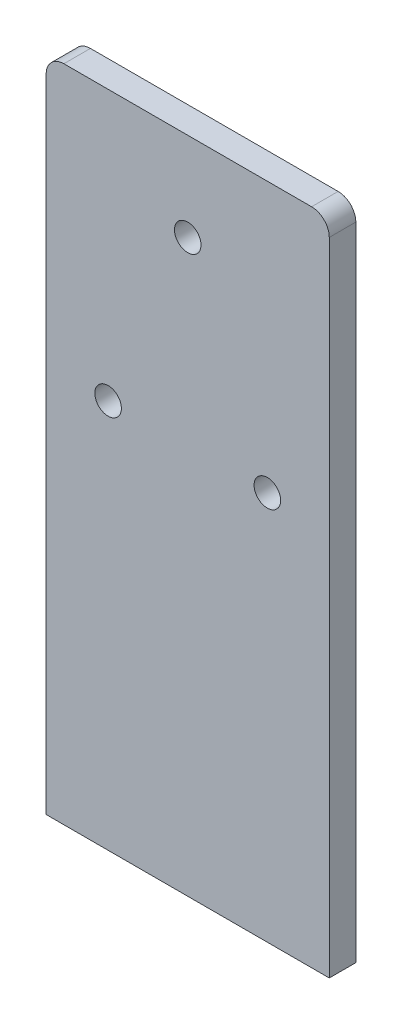
from build123d import *

# Parameters (mm, degrees)
CROQUIS1_W              = 32
CROQUIS1_H              = 74.5
CROQUIS1_R              = 1.5
SALIENTE_EXTRUIR1_DEPTH = 1.5
REDONDEO1_R             = 2


with BuildPart() as part:
    # Croquis1 → Saliente-Extruir1 (new, symmetric)
    with BuildSketch(Plane.XY):
        Rectangle(CROQUIS1_W, CROQUIS1_H)
        with Locations((0, 27.25)):
            Circle(CROQUIS1_R, mode=Mode.SUBTRACT)
        with Locations((-9, 6.75)):
            Circle(CROQUIS1_R, mode=Mode.SUBTRACT)
        with Locations((9, 6.75)):
            Circle(CROQUIS1_R, mode=Mode.SUBTRACT)
    extrude(amount=SALIENTE_EXTRUIR1_DEPTH, both=True)

    # Redondeo1
    redondeo1_edges = [part.edges().sort_by_distance(p)[0] for p in [
        (16, 37.25, 0),
        (-16, 37.25, 0),
    ]]
    fillet(redondeo1_edges, radius=REDONDEO1_R)


solid = part.part
